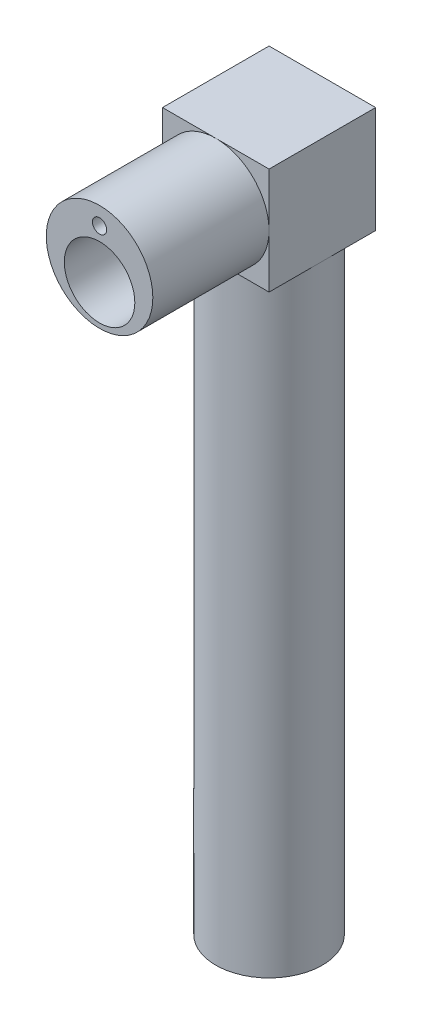
from build123d import *

# Parameters (mm, degrees)
SKETCH1_R           = 28.1
BOSS_EXTRUDE2_DEPTH = 61.3
SKETCH3_R           = 18.6
CUT_EXTRUDE2_DEPTH  = 58.8
SKETCH4_W           = 56.2
SKETCH4_H           = 56.2
BOSS_EXTRUDE3_DEPTH = 56.2
SKETCH5_R           = 16.1
CUT_EXTRUDE4_DEPTH  = 5
SKETCH6_W           = 49.797391422
SKETCH6_H           = 49.779255452
CUT_EXTRUDE5_DEPTH  = 53.7
SKETCH7_R           = 28.1
BOSS_EXTRUDE4_DEPTH = 321.5
CUT_EXTRUDE6_DEPTH  = 10
SKETCH9_R           = 3
CUT_EXTRUDE7_DEPTH  = 1
SKETCH10_R          = 6.025
CUT_EXTRUDE8_DEPTH  = 0.1
SKETCH18_R          = 3.75
CUT_EXTRUDE9_DEPTH  = 100
SKETCH19_R          = 3.75
CUT_EXTRUDE11_DEPTH = 325


with BuildPart() as part:
    # Sketch1 → Boss-Extrude2 (new body)
    with BuildSketch(Plane.XY):
        Circle(SKETCH1_R)
    extrude(amount=BOSS_EXTRUDE2_DEPTH)

    # Sketch3 → Cut-Extrude2 (cut)
    with BuildSketch(Plane.XY.offset(61.3)):
        with Locations((0, -7)):
            Circle(SKETCH3_R)
    extrude(amount=-CUT_EXTRUDE2_DEPTH, mode=Mode.SUBTRACT)

    # Sketch4 → Boss-Extrude3 (add)
    with BuildSketch(Plane(origin=(0, 0, 0), x_dir=(-1, 0, 0), z_dir=(0, 0, -1))):
        Rectangle(SKETCH4_W, SKETCH4_H)
    extrude(amount=BOSS_EXTRUDE3_DEPTH)

    # Sketch5 → Cut-Extrude4 (cut)
    with BuildSketch(Plane.XY.offset(2.5)):
        with Locations((0, -7)):
            Circle(SKETCH5_R)
    extrude(amount=-CUT_EXTRUDE4_DEPTH, mode=Mode.SUBTRACT)

    # Sketch6 → Cut-Extrude5 (cut)
    with BuildSketch(Plane(origin=(0, 0, -56.2), x_dir=(-1, 0, 0), z_dir=(0, 0, -1))):
        Rectangle(SKETCH6_W, SKETCH6_H)
    extrude(amount=-CUT_EXTRUDE5_DEPTH, mode=Mode.SUBTRACT)

    # Sketch7 → Boss-Extrude4 (add)
    with BuildSketch(Plane(origin=(0, -28.1, 0), x_dir=(-1, 0, 0), z_dir=(0, -1, 0))):
        with Locations((0, 28.1)):
            Circle(SKETCH7_R)
    extrude(amount=BOSS_EXTRUDE4_DEPTH)

    # Sketch8 → Cut-Extrude6 (cut)
    with BuildSketch(Plane(origin=(0, -349.6, 0), x_dir=(-1, 0, 0), z_dir=(0, -1, 0))):
        with BuildLine():
            Line((-1.658312395, 25.832078896), (1.658312395, 25.832078896))
            ThreePointArc((1.658312395, 25.832078896), (3, 28.332078896), (1.658312395, 30.832078896))
            Line((1.658312395, 30.832078896), (-1.658312395, 30.832078896))
            ThreePointArc((-1.658312395, 30.832078896), (-3, 28.332078896), (-1.658312395, 25.832078896))
        make_face()
    extrude(amount=-CUT_EXTRUDE6_DEPTH, mode=Mode.SUBTRACT)

    # Sketch9 → Cut-Extrude7 (cut)
    with BuildSketch(Plane(origin=(0, -349.6, 0), x_dir=(-1, 0, 0), z_dir=(0, -1, 0))):
        with Locations((0, 28.332078896)):
            Circle(SKETCH9_R)
    extrude(amount=-CUT_EXTRUDE7_DEPTH, mode=Mode.SUBTRACT)

    # Sketch10 → Cut-Extrude8 (cut)
    with BuildSketch(Plane(origin=(0, -349.6, 0), x_dir=(-1, 0, 0), z_dir=(0, -1, 0))):
        with Locations((0, 28.332078896)):
            Circle(SKETCH10_R)
    extrude(amount=-CUT_EXTRUDE8_DEPTH, mode=Mode.SUBTRACT)

    # Cut-Sweep4: sweep along a path in Sketch15
    with BuildLine(Plane(origin=(0, -349.6, 0), x_dir=(-1, 0, 0), z_dir=(0, -1, 0))) as cut_sweep4_path:
        ThreePointArc((15, 28.332078896), (0, 43.332078896), (-15, 28.332078896))
    # 3DSketch2 → Cut-Sweep4 (sweep, cut)
    with BuildSketch(Plane(origin=(-15, -349.6, -28.332078896), x_dir=(-0.022748965612757834, 0.999741208795331, 0), z_dir=(0, 0, 1))):
        Polygon((0, 0), (0.170617242, 7.498059066), (329.685319661, 0), (329.514702419, -7.498059066), align=None)
    sweep(path=cut_sweep4_path.line, mode=Mode.SUBTRACT)

    # Sketch18 → Cut-Extrude9 (cut)
    with BuildSketch(Plane.XY.offset(61.3)):
        with Locations((0, 18.75)):
            Circle(SKETCH18_R)
    extrude(amount=-CUT_EXTRUDE9_DEPTH, mode=Mode.SUBTRACT)

    # Sketch19 → Cut-Extrude11 (cut)
    with BuildSketch(Plane(origin=(0, -349.6, 0), x_dir=(-1, 0, 0), z_dir=(0, -1, 0))):
        with Locations((-18.75, 28.332078896)):
            Circle(SKETCH19_R)
        with Locations((18.75, 28.332078896)):
            Circle(SKETCH19_R)
    extrude(amount=-CUT_EXTRUDE11_DEPTH, mode=Mode.SUBTRACT)


solid = part.part
